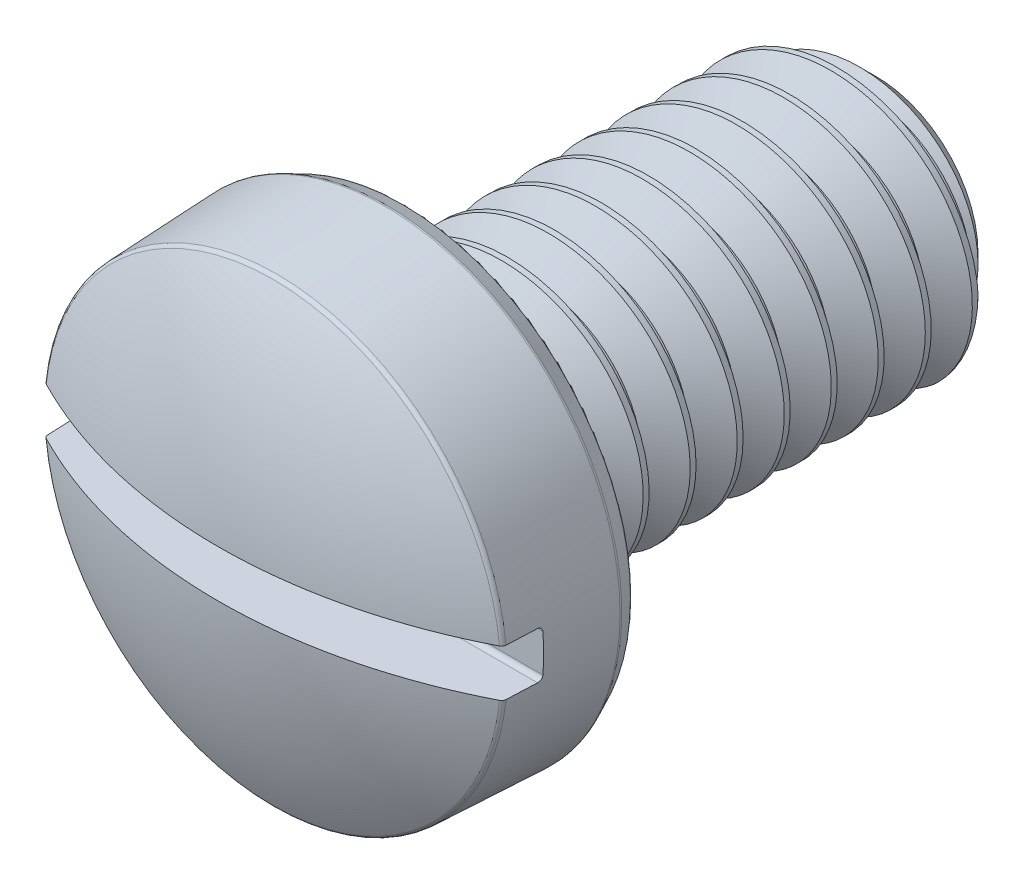
from build123d import *

# Parameters (mm, degrees)
CUT_EXTRUDE1_DEPTH      = 6.969924623
CUT_EXTRUDE1_DEPTH_BACK = 6.969924623
SKETCH3_W               = 1.2
SKETCH3_H               = 0.6
FILLET1_R               = 0.06
CUT_SWEEP1_PITCH        = 0.6


# Read off the part's stored shape, not the designer's step: Split1, Boss-Extrude1
with BuildPart() as part:
    # Sketch2 → Revolve1 (revolve)
    with BuildSketch(Plane(origin=(0, 0, 0), x_dir=(0, 0, -1), z_dir=(1, 0, 0)), mode=Mode.PRIVATE) as revolve1_sk:
        with BuildLine():
            Line((-3.48, 2.937652174), (-2.052, 3))
            Line((-2.052, 3), (-1.8, 2.88249047))
            Line((-1.8, 2.88249047), (-1.8, 1.785))
            Line((-1.8, 1.785), (-1.5, 1.785))
            Line((-1.5, 1.785), (-1.5, 1.75))
            Line((-1.5, 1.75), (3.75, 1.75))
            Line((3.75, 1.75), (4.2, 1.3))
            Line((4.2, 1.3), (4.2, 0))
            Line((4.2, 0), (-4.2, 0))
            ThreePointArc((-4.2, 0), (-4.017375075, 1.512299598), (-3.48, 2.937652174))
        make_face()
    revolve(revolve1_sk.sketch.rotate(Axis((0, 0, 4.2), (0, 0, -1)), 90), axis=Axis((0, 0, 4.2), (0, 0, -1)))

    # Sketch3 → Cut-Extrude1 (cut, two sides: drawn at the far end of the back side and taken through both)
    with BuildSketch(Plane(origin=(0, 0, 0), x_dir=(0, 0, -1), z_dir=(1, 0, 0)).offset(-CUT_EXTRUDE1_DEPTH_BACK)):
        with Locations((-3.6, 0)):
            Rectangle(SKETCH3_W, SKETCH3_H)
    extrude(amount=CUT_EXTRUDE1_DEPTH + CUT_EXTRUDE1_DEPTH_BACK, mode=Mode.SUBTRACT)

    # Fillet1
    fillet1_edges = [part.edges().sort_by_distance(p)[0] for p in [
        (0, 0.3, 3),
        (0, -0.3, 3),
        (0, -2.937652174, 3.48),
        (0, 2.937652174, 3.48),
        (-2.88249047, 0, 1.8),
        (-3, 0, 2.052),
        (-1.785, 0, 1.8),
    ]]
    fillet(fillet1_edges, radius=FILLET1_R)


with BuildPart() as body_2:
    # Split1: the piece on the far side of the plane
    add(part.part)
    split(bisect_by=Plane.XY.offset(1.5), keep=Keep.BOTTOM)

    # Cut-Sweep1: the profile of Sketch5 profile screwed along a right-hand helix of 11 turns, 6 arcs to a turn; built about Z, then put on its axis
    cut_sweep1_z = Axis((0, 0, 0), (0, 0, 1))
    cut_sweep1_corners = [(1.7503, 0, 0.000173205), (1.7503, 0, -0.525173205), (1.360288568, 0, -0.3), (1.360288568, 0, -0.225)]
    with BuildLine(mode=Mode.PRIVATE) as cut_sweep1_profile:
        Line(cut_sweep1_corners[0], cut_sweep1_corners[1])
        Line(cut_sweep1_corners[1], cut_sweep1_corners[2])
        Line(cut_sweep1_corners[2], cut_sweep1_corners[3])
        Line(cut_sweep1_corners[3], cut_sweep1_corners[0])
    cut_sweep1_cap = Face(cut_sweep1_profile.wire())
    cut_sweep1_turn_angles = [0, 30, 60, 90, 120, 150, 180, 210, 240, 270, 300, 330, 360]
    cut_sweep1_turn_weights = [1, 0.8660254037844387, 1, 0.8660254037844387, 1, 0.8660254037844387, 1, 0.8660254037844387, 1, 0.8660254037844387, 1, 0.8660254037844387, 1]
    cut_sweep1_turn_rails = [Edge.make_bspline([Vector(p[0], p[1], 0).rotate(cut_sweep1_z, cut_sweep1_turn_angles[k]) / cut_sweep1_turn_weights[k] + Vector(0, 0, p[2] + CUT_SWEEP1_PITCH * cut_sweep1_turn_angles[k] / 360) for k in range(13)], [0, 0, 0, 1, 1, 2, 2, 3, 3, 4, 4, 5, 5, 6, 6, 6], 2, cut_sweep1_turn_weights) for p in cut_sweep1_corners]
    cut_sweep1_turn_sides = [Face.make_surface_from_curves(cut_sweep1_turn_rails[p[0]], cut_sweep1_turn_rails[p[1]]) for p in [(0, 1), (1, 2), (2, 3), (3, 0)]]
    cut_sweep1_turn = Solid(Shell([*cut_sweep1_turn_sides, cut_sweep1_cap, cut_sweep1_cap.rotate(cut_sweep1_z, 360).moved(Location((0, 0, CUT_SWEEP1_PITCH * 360 / 360)))]))
    cut_sweep1_each = [*[cut_sweep1_turn.moved(Location((0, 0, CUT_SWEEP1_PITCH * i))) for i in range(11)]]
    add(Plane(origin=(0, 0, -4.2), x_dir=(0, 1, 0), z_dir=(0, 0, 1)) * Compound([cut_sweep1_each[i] for i in range(0, 11, 2)]), mode=Mode.SUBTRACT)
    add(Plane(origin=(0, 0, -4.2), x_dir=(0, 1, 0), z_dir=(0, 0, 1)) * Compound([cut_sweep1_each[i] for i in range(1, 11, 2)]), mode=Mode.SUBTRACT)


with BuildPart() as part_1:
    add(part.part)

    # Split1
    split(bisect_by=Plane.XY.offset(1.5), keep=Keep.TOP)

    add(body_2.part)  # Boss-Extrude1 merges body 2
    # Boss-Extrude1 outline → Boss-Extrude1 (revolve)
    with BuildSketch(Plane.XZ):
        Polygon((1.360282293, 1.5), (1.360282293, 1.254789118), (1.785, 1.5), align=None)
    revolve(axis=Axis((0, 0, 0), (0, 0, 1)))


solid = part_1.part
